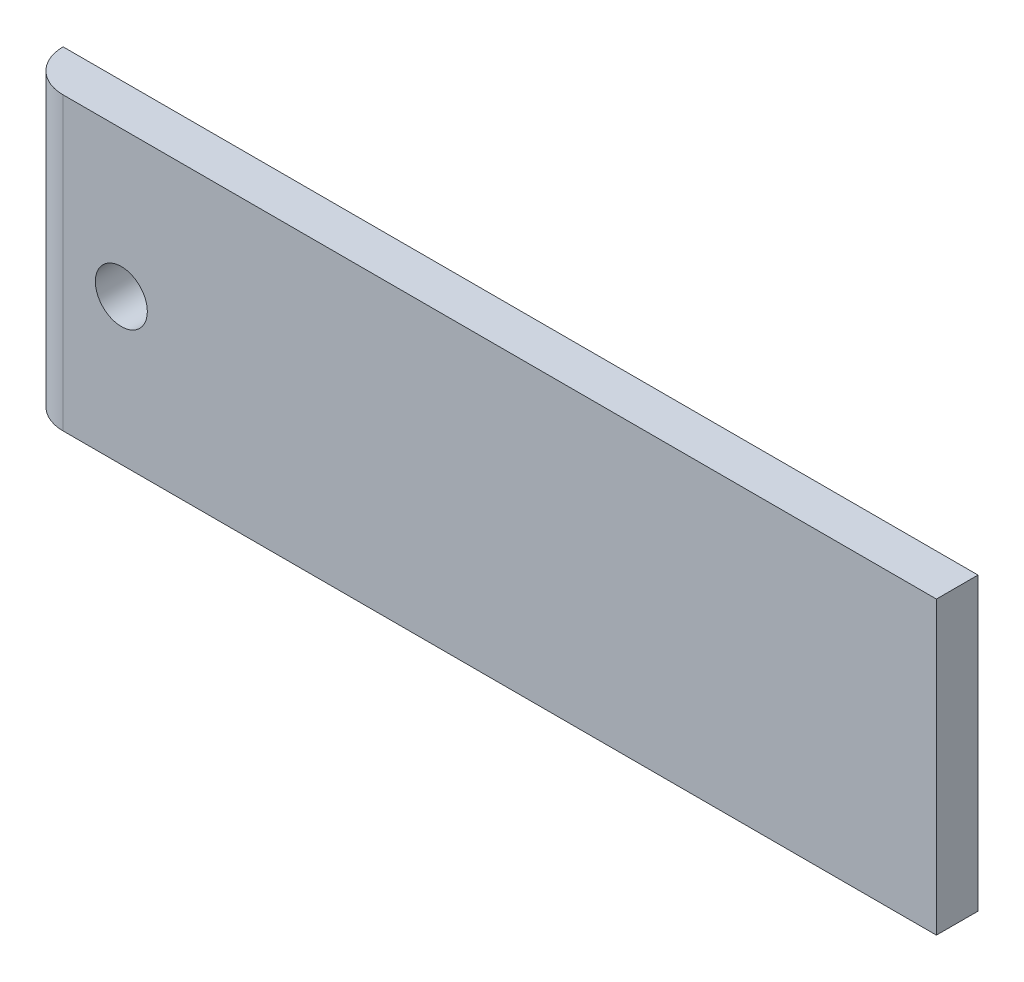
from build123d import *

# Parameters (mm, degrees)
SKETCH1_W           = 139.7
SKETCH1_H           = 6.35
BOSS_EXTRUDE1_DEPTH = 44.45
FILLET1_R           = 6.35
SKETCH4_R           = 3.96875
CUT_EXTRUDE2_DEPTH  = 254


with BuildPart() as part:
    # Sketch1 → Boss-Extrude1 (new body)
    with BuildSketch(Plane(origin=(0, 0, 0), x_dir=(1, 0, 0), z_dir=(0, 1, 0))):
        with Locations((69.85, 3.175)):
            Rectangle(SKETCH1_W, SKETCH1_H)
    extrude(amount=BOSS_EXTRUDE1_DEPTH)

    # Fillet1
    fillet1_edges = [part.edges().sort_by_distance(p)[0] for p in [
        (0, 22.225, 0),
    ]]
    fillet(fillet1_edges, radius=FILLET1_R - 0.0001)  # a hair under: the kernel refuses the full size

    # Sketch4 → Cut-Extrude2 (cut)
    with BuildSketch(Plane(origin=(69.948790088, 1.415162488, 0), x_dir=(1, 0, 0), z_dir=(0, 0, 1))):
        with Locations((-54.708790088, 20.809837512)):
            Circle(SKETCH4_R)
    extrude(amount=-CUT_EXTRUDE2_DEPTH, mode=Mode.SUBTRACT)


solid = part.part
